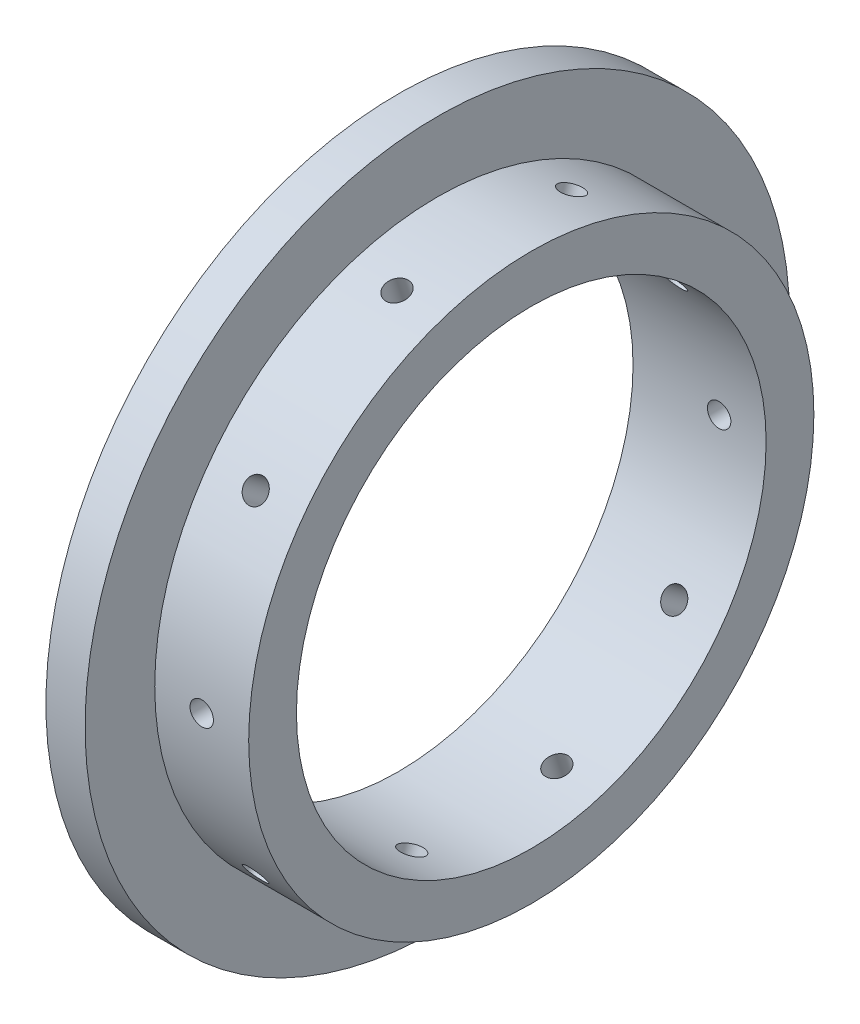
from build123d import *

# Parameters (mm, degrees)
SKETCH1_R           = 57.15
SKETCH1_R_2         = 38.1
BOSS_EXTRUDE1_DEPTH = 6.35
SKETCH2_R           = 45.847
SKETCH2_R_2         = 38.1
BOSS_EXTRUDE2_DEPTH = 15.24
SKETCH4_R           = 1.89865
CUT_EXTRUDE1_DEPTH  = 11.43
CIRPATTERN1_COUNT   = 10


with BuildPart() as part:
    # Sketch1 → Boss-Extrude1 (new body)
    with BuildSketch(Plane(origin=(0, 0, 0), x_dir=(0, 0, -1), z_dir=(1, 0, 0))):
        Circle(SKETCH1_R)
        Circle(SKETCH1_R_2, mode=Mode.SUBTRACT)
    extrude(amount=BOSS_EXTRUDE1_DEPTH)

    # Sketch2 → Boss-Extrude2 (add)
    with BuildSketch(Plane(origin=(6.35, 0, 0), x_dir=(0, 0, -1), z_dir=(1, 0, 0))):
        Circle(SKETCH2_R)
        Circle(SKETCH2_R_2, mode=Mode.SUBTRACT)
    extrude(amount=BOSS_EXTRUDE2_DEPTH)

    # Sketch4 → Cut-Extrude1 (cut)
    with BuildSketch(Plane(origin=(0, 0, -45.847), x_dir=(-1, 0, 0), z_dir=(0, 0, -1))):
        with Locations((-13.97, 0)):
            Circle(SKETCH4_R)
    cut_extrude1 = extrude(amount=-CUT_EXTRUDE1_DEPTH, mode=Mode.SUBTRACT)

    # CirPattern1: Cut-Extrude1 ×10 about axis
    cirpattern1_axis = Axis((0, 0, 0), (1, 0, 0))
    for i in range(1, CIRPATTERN1_COUNT):
        add(cut_extrude1.rotate(cirpattern1_axis, i * 360 / CIRPATTERN1_COUNT), mode=Mode.SUBTRACT)


solid = part.part
